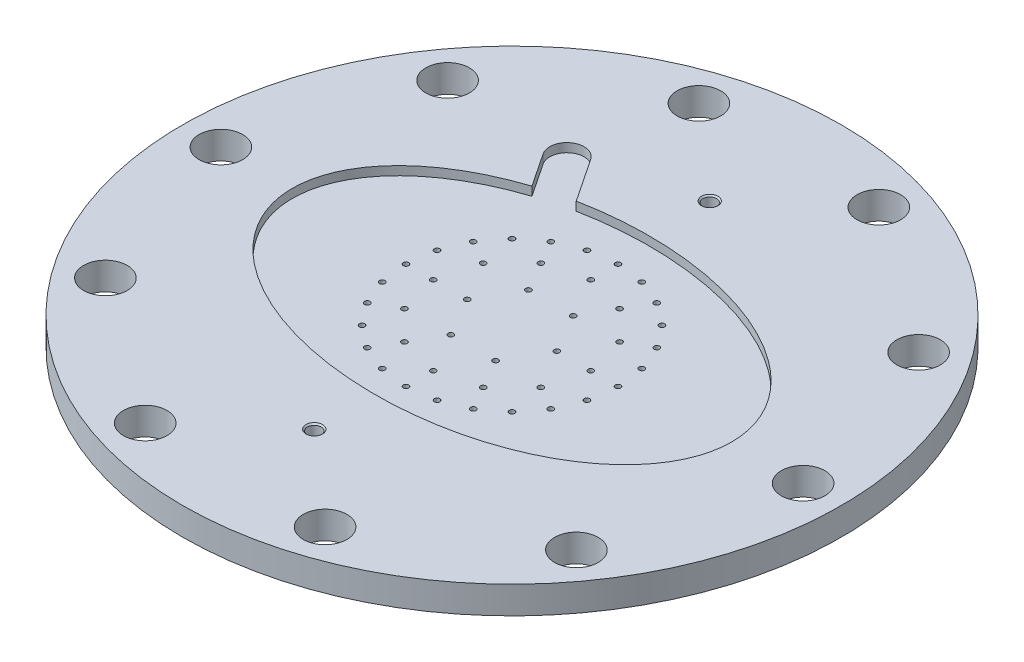
from build123d import *

# Parameters (mm, degrees)
F_3_8_CLEARANCE_HOLE1_D                = 10.0838
CIRPATTERN1_COUNT                      = 10
SKETCH5_RX                             = 50.8
SKETCH5_RY                             = 31.75
CUT_EXTRUDE1_DEPTH                     = 2.032
SKETCH6_R                              = 0.635
CUT_EXTRUDE2_DEPTH                     = 108.849548557
F_1_8_0_125_DIAMETER_HOLE1_D           = 3.175
F_1_8_0_125_DIAMETER_HOLE1_DEPTH       = 2.856133767
F_1_8_0_125_DIAMETER_HOLE1_CSINK_D     = 3.81
F_1_8_0_125_DIAMETER_HOLE1_CSINK_ANGLE = 90
F_1_8_0_125_DIAMETER_HOLE1_TIP         = 0.953866233


with BuildPart() as part:
    # Sketch1 → Revolve1 (revolve)
    with BuildSketch(Plane.XY):
        Polygon((0, -6.35), (54.8259, -6.35), (54.8259, -3.6576), (58.8899, -3.6576), (58.8899, -6.35), (76.2, -6.35), (76.2, 0), (0, 0), align=None)
    revolve(axis=Axis((0, 0, 0), (0, -1, 0)))

    # 3/8 Clearance Hole1 (through all)
    with Locations(Plane(origin=(67.31, 0, 0), x_dir=(0, 0, 1), z_dir=(0, 1, 0))):
        with Locations((0, 0)):
            f_3_8_clearance_hole1 = Hole(F_3_8_CLEARANCE_HOLE1_D / 2)

    # CirPattern1: 3/8 Clearance Hole1 ×10 about axis
    cirpattern1_axis = Axis((0, 0.3175, 0), (0, -1, 0))
    for i in range(1, CIRPATTERN1_COUNT):
        add(f_3_8_clearance_hole1.rotate(cirpattern1_axis, i * 360 / CIRPATTERN1_COUNT), mode=Mode.SUBTRACT)

    # Sketch5 → Cut-Extrude1 (cut)
    with BuildSketch(Plane(origin=(0, 0, 0), x_dir=(1, 0, 0), z_dir=(0, 1, 0))):
        with Locations((0, 0)):
            Ellipse(SKETCH5_RX, SKETCH5_RY)
        with BuildLine():
            Line((-3.302199606, -2.201466404), (-28.702199606, 35.898533596))
            ThreePointArc((-28.702199606, 35.898533596), (-27.601466404, 41.402199606), (-22.097800394, 40.301466404))
            Line((-22.097800394, 40.301466404), (3.302199606, 2.201466404))
            ThreePointArc((3.302199606, 2.201466404), (2.201466404, -3.302199606), (-3.302199606, -2.201466404))
        make_face()
    extrude(amount=-CUT_EXTRUDE1_DEPTH, mode=Mode.SUBTRACT)

    # Sketch6 → Cut-Extrude2 (cut, through all)
    with BuildSketch(Plane(origin=(0, -2.032, 0), x_dir=(1, 0, 0), z_dir=(0, 1, 0))):
        with Locations((-5.1816, -8.974794464)):
            Circle(SKETCH6_R)
        with Locations((5.1816, -8.974794464)):
            Circle(SKETCH6_R)
        with Locations((24.511, 0)):
            Circle(SKETCH6_R)
        with Locations((18.2118, 0)):
            Circle(SKETCH6_R)
        with Locations((10.3632, 0)):
            Circle(SKETCH6_R)
        with Locations((0, -18.2118)):
            Circle(SKETCH6_R)
        with Locations((9.1059, -15.771881449)):
            Circle(SKETCH6_R)
        with Locations((15.771881449, -9.1059)):
            Circle(SKETCH6_R)
        with Locations((5.1816, 8.974794464)):
            Circle(SKETCH6_R)
        with Locations((-5.1816, 8.974794464)):
            Circle(SKETCH6_R)
        with Locations((-10.3632, 0)):
            Circle(SKETCH6_R)
        with Locations((15.771881449, 9.1059)):
            Circle(SKETCH6_R)
        with Locations((9.1059, 15.771881449)):
            Circle(SKETCH6_R)
        with Locations((0, 18.2118)):
            Circle(SKETCH6_R)
        with Locations((-9.1059, 15.771881449)):
            Circle(SKETCH6_R)
        with Locations((-15.771881449, 9.1059)):
            Circle(SKETCH6_R)
        with Locations((-18.2118, 0)):
            Circle(SKETCH6_R)
        with Locations((-15.771881449, -9.1059)):
            Circle(SKETCH6_R)
        with Locations((-9.1059, -15.771881449)):
            Circle(SKETCH6_R)
        with Locations((-6.343913615, -23.675807928)):
            Circle(SKETCH6_R)
        with Locations((0, -24.511)):
            Circle(SKETCH6_R)
        with Locations((6.343913615, -23.675807928)):
            Circle(SKETCH6_R)
        with Locations((12.2555, -21.227148672)):
            Circle(SKETCH6_R)
        with Locations((17.331894314, -17.331894314)):
            Circle(SKETCH6_R)
        with Locations((21.227148672, -12.2555)):
            Circle(SKETCH6_R)
        with Locations((23.675807928, -6.343913615)):
            Circle(SKETCH6_R)
        with Locations((-17.331894314, 17.331894314)):
            Circle(SKETCH6_R)
        with Locations((-21.227148672, 12.2555)):
            Circle(SKETCH6_R)
        with Locations((-23.675807928, 6.343913615)):
            Circle(SKETCH6_R)
        with Locations((-24.511, 0)):
            Circle(SKETCH6_R)
        with Locations((-23.675807928, -6.343913615)):
            Circle(SKETCH6_R)
        with Locations((-21.227148672, -12.2555)):
            Circle(SKETCH6_R)
        with Locations((-17.331894314, -17.331894314)):
            Circle(SKETCH6_R)
        with Locations((-12.2555, -21.227148672)):
            Circle(SKETCH6_R)
        with Locations((23.675807928, 6.343913615)):
            Circle(SKETCH6_R)
        with Locations((21.227148672, 12.2555)):
            Circle(SKETCH6_R)
        with Locations((17.331894314, 17.331894314)):
            Circle(SKETCH6_R)
        with Locations((12.2555, 21.227148672)):
            Circle(SKETCH6_R)
        with Locations((6.343913615, 23.675807928)):
            Circle(SKETCH6_R)
        with Locations((0, 24.511)):
            Circle(SKETCH6_R)
        with Locations((-6.343913615, 23.675807928)):
            Circle(SKETCH6_R)
        with Locations((-12.2555, 21.227148672)):
            Circle(SKETCH6_R)
    extrude(amount=-CUT_EXTRUDE2_DEPTH, mode=Mode.SUBTRACT)

    # 1/8 (0.125) Diameter Hole1
    with Locations(Plane(origin=(0, 0, -45.72), x_dir=(0, 0, 1), z_dir=(0, 1, 0))):
        with Locations((0, 0), (91.44, 0)):
            CounterSinkHole(F_1_8_0_125_DIAMETER_HOLE1_D / 2, F_1_8_0_125_DIAMETER_HOLE1_CSINK_D / 2, depth=F_1_8_0_125_DIAMETER_HOLE1_DEPTH, counter_sink_angle=F_1_8_0_125_DIAMETER_HOLE1_CSINK_ANGLE)
            with Locations((0, 0, -(F_1_8_0_125_DIAMETER_HOLE1_DEPTH + F_1_8_0_125_DIAMETER_HOLE1_TIP / 2))):  # 118° drill point
                Cone(0, F_1_8_0_125_DIAMETER_HOLE1_D / 2, F_1_8_0_125_DIAMETER_HOLE1_TIP, mode=Mode.SUBTRACT)


solid = part.part
